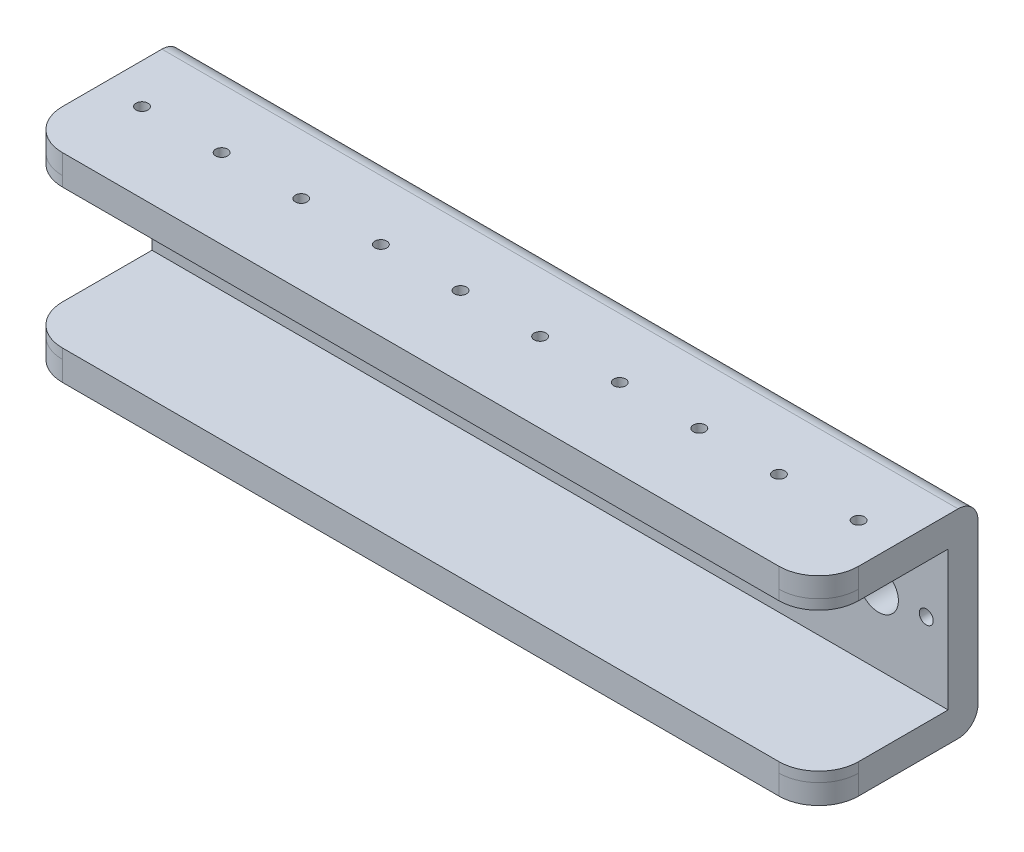
from build123d import *

# Parameters (mm, degrees)
SKETCH1_W           = 400
SKETCH1_H           = 80
BOSS_EXTRUDE1_DEPTH = 10
SKETCH2_W           = 400
SKETCH2_H           = 10
BOSS_EXTRUDE2_DEPTH = 80
SKETCH3_W           = 400
SKETCH3_H           = 10
BOSS_EXTRUDE3_DEPTH = 10
SKETCH4_W           = 400
SKETCH4_H           = 10
BOSS_EXTRUDE4_DEPTH = 70
FILLET1_R           = 20
FILLET2_R           = 10
CUT_EXTRUDE2_REACH  = 361.504
SKETCH6_R           = 2.5
SKETCH8_R           = 3.5
SKETCH8_R_2         = 10
SKETCH8_R_3         = 8.5
CUT_EXTRUDE3_DEPTH  = 10
CUT_EXTRUDE4_REACH  = 361.504
SKETCH9_R           = 3.5
SKETCH10_R          = 3.5
BOSS_EXTRUDE5_DEPTH = 10
CUT_EXTRUDE5_REACH  = 358.158
SKETCH11_R          = 3
SKETCH13_W          = 400
SKETCH13_H          = 80
SKETCH13_R          = 3.5
SKETCH13_R_2        = 10
SKETCH13_R_3        = 8.5
SKETCH13_R_4        = 2.5
BOSS_EXTRUDE7_DEPTH = 5
SKETCH16_W          = 400
SKETCH16_H          = 65
BOSS_EXTRUDE8_DEPTH = 5
FILLET3_R           = 20
SKETCH17_W          = 400
SKETCH17_H          = 65
SKETCH17_R          = 3
BOSS_EXTRUDE9_DEPTH = 5
FILLET4_R           = 20


with BuildPart() as part:
    # Sketch1 → Boss-Extrude1 (new body)
    with BuildSketch(Plane(origin=(0, 0, 0), x_dir=(1, 0, 0), z_dir=(0, 1, 0))):
        with Locations((135.921268108, 23.289271879)):
            Rectangle(SKETCH1_W, SKETCH1_H)
    extrude(amount=BOSS_EXTRUDE1_DEPTH)

    # Sketch2 → Boss-Extrude2 (add)
    with BuildSketch(Plane(origin=(0, 10, 0), x_dir=(1, 0, 0), z_dir=(0, 1, 0))):
        with Locations((135.921268108, 58.289271879)):
            Rectangle(SKETCH2_W, SKETCH2_H)
    extrude(amount=BOSS_EXTRUDE2_DEPTH)

    # Sketch3 → Boss-Extrude3 (add)
    with BuildSketch(Plane(origin=(0, 90, 0), x_dir=(1, 0, 0), z_dir=(0, 1, 0))):
        with Locations((135.921268108, 58.289271879)):
            Rectangle(SKETCH3_W, SKETCH3_H)
    extrude(amount=BOSS_EXTRUDE3_DEPTH)

    # Sketch4 → Boss-Extrude4 (add)
    with BuildSketch(Plane.XY.offset(-53.289271879)):
        with Locations((135.921268108, 95)):
            Rectangle(SKETCH4_W, SKETCH4_H)
    extrude(amount=BOSS_EXTRUDE4_DEPTH)

    # Fillet1
    fillet1_edges = [part.edges().sort_by_distance(p)[0] for p in [
        (-64.078731892, 95, 16.710728121),
        (335.921268108, 95, 16.710728121),
        (-64.078731892, 5, 16.710728121),
        (335.921268108, 5, 16.710728121),
    ]]
    fillet(fillet1_edges, radius=FILLET1_R)

    # Fillet2
    fillet2_edges = [part.edges().sort_by_distance(p)[0] for p in [
        (135.921268108, 100, -63.289271879),
        (135.921268108, 0, -63.289271879),
    ]]
    fillet(fillet2_edges, radius=FILLET2_R)

    # Sketch6 → Cut-Extrude2 (cut, up to next)
    with BuildSketch(Plane(origin=(0, 0, -63.289271879), x_dir=(-1, 0, 0), z_dir=(0, 0, -1)), mode=Mode.PRIVATE) as cut_extrude2_sk1:
        with Locations((-112.351268108, 73.57)):
            Circle(SKETCH6_R)
    cut_extrude2_tool1 = extrude(cut_extrude2_sk1.sketch, amount=-CUT_EXTRUDE2_REACH, mode=Mode.PRIVATE) & part.part
    # Sketch6 → Cut-Extrude2 (cut, up to next)
    with BuildSketch(Plane(origin=(0, 0, -63.289271879), x_dir=(-1, 0, 0), z_dir=(0, 0, -1)), mode=Mode.PRIVATE) as cut_extrude2_sk2:
        with Locations((-112.351268108, 26.43)):
            Circle(SKETCH6_R)
    cut_extrude2_tool2 = extrude(cut_extrude2_sk2.sketch, amount=-CUT_EXTRUDE2_REACH, mode=Mode.PRIVATE) & part.part
    # Sketch6 → Cut-Extrude2 (cut, up to next)
    with BuildSketch(Plane(origin=(0, 0, -63.289271879), x_dir=(-1, 0, 0), z_dir=(0, 0, -1)), mode=Mode.PRIVATE) as cut_extrude2_sk3:
        with Locations((-159.491268108, 26.43)):
            Circle(SKETCH6_R)
    cut_extrude2_tool3 = extrude(cut_extrude2_sk3.sketch, amount=-CUT_EXTRUDE2_REACH, mode=Mode.PRIVATE) & part.part
    # Sketch6 → Cut-Extrude2 (cut, up to next)
    with BuildSketch(Plane(origin=(0, 0, -63.289271879), x_dir=(-1, 0, 0), z_dir=(0, 0, -1)), mode=Mode.PRIVATE) as cut_extrude2_sk4:
        with Locations((-159.491268108, 73.57)):
            Circle(SKETCH6_R)
    cut_extrude2_tool4 = extrude(cut_extrude2_sk4.sketch, amount=-CUT_EXTRUDE2_REACH, mode=Mode.PRIVATE) & part.part
    add(cut_extrude2_tool1.solids().sort_by_distance((112.351268, 73.57, -63.289272))[0], mode=Mode.SUBTRACT)
    add(cut_extrude2_tool2.solids().sort_by_distance((112.351268, 26.43, -63.289272))[0], mode=Mode.SUBTRACT)
    add(cut_extrude2_tool3.solids().sort_by_distance((159.491268, 26.43, -63.289272))[0], mode=Mode.SUBTRACT)
    add(cut_extrude2_tool4.solids().sort_by_distance((159.491268, 73.57, -63.289272))[0], mode=Mode.SUBTRACT)

    # Sketch8 → Cut-Extrude3 (cut)
    with BuildSketch(Plane(origin=(0, 0, -63.289271879), x_dir=(-1, 0, 0), z_dir=(0, 0, -1))):
        with Locations((53.078731892, 50)):
            Circle(SKETCH8_R)
        with Locations((5.078731892, 50)):
            Circle(SKETCH8_R)
        with Locations((29.078731892, 50)):
            Circle(SKETCH8_R_2)
        with Locations((-276.921268108, 50)):
            Circle(SKETCH8_R)
        with Locations((-300.921268108, 50)):
            Circle(SKETCH8_R_2)
        with Locations((-135.921268108, 50)):
            Circle(SKETCH8_R_3)
        with Locations((-109.421268108, 50)):
            Circle(SKETCH8_R)
        with Locations((-162.421268108, 50)):
            Circle(SKETCH8_R)
        with Locations((-324.921268108, 50)):
            Circle(SKETCH8_R)
    extrude(amount=-CUT_EXTRUDE3_DEPTH, mode=Mode.SUBTRACT)

    # Sketch9 → Cut-Extrude4 (cut, up to next)
    with BuildSketch(Plane(origin=(0, 0, -63.289271879), x_dir=(-1, 0, 0), z_dir=(0, 0, -1)), mode=Mode.PRIVATE) as cut_extrude4_sk1:
        with Locations((-135.921268108, 76.5)):
            Circle(SKETCH9_R)
    cut_extrude4_tool1 = extrude(cut_extrude4_sk1.sketch, amount=-CUT_EXTRUDE4_REACH, mode=Mode.PRIVATE) & part.part
    # Sketch9 → Cut-Extrude4 (cut, up to next)
    with BuildSketch(Plane(origin=(0, 0, -63.289271879), x_dir=(-1, 0, 0), z_dir=(0, 0, -1)), mode=Mode.PRIVATE) as cut_extrude4_sk2:
        with Locations((-135.921268108, 23.5)):
            Circle(SKETCH9_R)
    cut_extrude4_tool2 = extrude(cut_extrude4_sk2.sketch, amount=-CUT_EXTRUDE4_REACH, mode=Mode.PRIVATE) & part.part
    add(cut_extrude4_tool1.solids().sort_by_distance((135.921268, 76.5, -63.289272))[0], mode=Mode.SUBTRACT)
    add(cut_extrude4_tool2.solids().sort_by_distance((135.921268, 23.5, -63.289272))[0], mode=Mode.SUBTRACT)

    # Sketch10 → Boss-Extrude5 (add)
    with BuildSketch(Plane(origin=(0, 0, -63.289271879), x_dir=(-1, 0, 0), z_dir=(0, 0, -1))):
        with Locations((-109.421268108, 50)):
            Circle(SKETCH10_R)
        with Locations((-162.421268108, 50)):
            Circle(SKETCH10_R)
    extrude(amount=-BOSS_EXTRUDE5_DEPTH)

    # Sketch11 → Cut-Extrude5 (cut, up to next)
    with BuildSketch(Plane(origin=(0, 100, 0), x_dir=(1, 0, 0), z_dir=(0, 1, 0)), mode=Mode.PRIVATE) as cut_extrude5_sk1:
        with Locations(Location((-44.078731892, 23.289271879, 0), (0, 0, 270))):
            Circle(SKETCH11_R)
    cut_extrude5_tool1 = extrude(cut_extrude5_sk1.sketch, amount=-CUT_EXTRUDE5_REACH, mode=Mode.PRIVATE) & part.part
    # Sketch11 → Cut-Extrude5 (cut, up to next)
    with BuildSketch(Plane(origin=(0, 100, 0), x_dir=(1, 0, 0), z_dir=(0, 1, 0)), mode=Mode.PRIVATE) as cut_extrude5_sk2:
        with Locations(Location((-4.078731892, 23.289271879, 0), (0, 0, 270))):
            Circle(SKETCH11_R)
    cut_extrude5_tool2 = extrude(cut_extrude5_sk2.sketch, amount=-CUT_EXTRUDE5_REACH, mode=Mode.PRIVATE) & part.part
    # Sketch11 → Cut-Extrude5 (cut, up to next)
    with BuildSketch(Plane(origin=(0, 100, 0), x_dir=(1, 0, 0), z_dir=(0, 1, 0)), mode=Mode.PRIVATE) as cut_extrude5_sk3:
        with Locations(Location((35.921268108, 23.289271879, 0), (0, 0, 270))):
            Circle(SKETCH11_R)
    cut_extrude5_tool3 = extrude(cut_extrude5_sk3.sketch, amount=-CUT_EXTRUDE5_REACH, mode=Mode.PRIVATE) & part.part
    # Sketch11 → Cut-Extrude5 (cut, up to next)
    with BuildSketch(Plane(origin=(0, 100, 0), x_dir=(1, 0, 0), z_dir=(0, 1, 0)), mode=Mode.PRIVATE) as cut_extrude5_sk4:
        with Locations(Location((75.921268108, 23.289271879, 0), (0, 0, 270))):
            Circle(SKETCH11_R)
    cut_extrude5_tool4 = extrude(cut_extrude5_sk4.sketch, amount=-CUT_EXTRUDE5_REACH, mode=Mode.PRIVATE) & part.part
    # Sketch11 → Cut-Extrude5 (cut, up to next)
    with BuildSketch(Plane(origin=(0, 100, 0), x_dir=(1, 0, 0), z_dir=(0, 1, 0)), mode=Mode.PRIVATE) as cut_extrude5_sk5:
        with Locations(Location((115.921268108, 23.289271879, 0), (0, 0, 270))):
            Circle(SKETCH11_R)
    cut_extrude5_tool5 = extrude(cut_extrude5_sk5.sketch, amount=-CUT_EXTRUDE5_REACH, mode=Mode.PRIVATE) & part.part
    # Sketch11 → Cut-Extrude5 (cut, up to next)
    with BuildSketch(Plane(origin=(0, 100, 0), x_dir=(1, 0, 0), z_dir=(0, 1, 0)), mode=Mode.PRIVATE) as cut_extrude5_sk6:
        with Locations(Location((155.921268108, 23.289271879, 0), (0, 0, 270))):
            Circle(SKETCH11_R)
    cut_extrude5_tool6 = extrude(cut_extrude5_sk6.sketch, amount=-CUT_EXTRUDE5_REACH, mode=Mode.PRIVATE) & part.part
    # Sketch11 → Cut-Extrude5 (cut, up to next)
    with BuildSketch(Plane(origin=(0, 100, 0), x_dir=(1, 0, 0), z_dir=(0, 1, 0)), mode=Mode.PRIVATE) as cut_extrude5_sk7:
        with Locations(Location((195.921268108, 23.289271879, 0), (0, 0, 270))):
            Circle(SKETCH11_R)
    cut_extrude5_tool7 = extrude(cut_extrude5_sk7.sketch, amount=-CUT_EXTRUDE5_REACH, mode=Mode.PRIVATE) & part.part
    # Sketch11 → Cut-Extrude5 (cut, up to next)
    with BuildSketch(Plane(origin=(0, 100, 0), x_dir=(1, 0, 0), z_dir=(0, 1, 0)), mode=Mode.PRIVATE) as cut_extrude5_sk8:
        with Locations(Location((235.921268108, 23.289271879, 0), (0, 0, 270))):
            Circle(SKETCH11_R)
    cut_extrude5_tool8 = extrude(cut_extrude5_sk8.sketch, amount=-CUT_EXTRUDE5_REACH, mode=Mode.PRIVATE) & part.part
    # Sketch11 → Cut-Extrude5 (cut, up to next)
    with BuildSketch(Plane(origin=(0, 100, 0), x_dir=(1, 0, 0), z_dir=(0, 1, 0)), mode=Mode.PRIVATE) as cut_extrude5_sk9:
        with Locations(Location((275.921268108, 23.289271879, 0), (0, 0, 270))):
            Circle(SKETCH11_R)
    cut_extrude5_tool9 = extrude(cut_extrude5_sk9.sketch, amount=-CUT_EXTRUDE5_REACH, mode=Mode.PRIVATE) & part.part
    # Sketch11 → Cut-Extrude5 (cut, up to next)
    with BuildSketch(Plane(origin=(0, 100, 0), x_dir=(1, 0, 0), z_dir=(0, 1, 0)), mode=Mode.PRIVATE) as cut_extrude5_sk10:
        with Locations(Location((315.921268108, 23.289271879, 0), (0, 0, 270))):
            Circle(SKETCH11_R)
    cut_extrude5_tool10 = extrude(cut_extrude5_sk10.sketch, amount=-CUT_EXTRUDE5_REACH, mode=Mode.PRIVATE) & part.part
    add(cut_extrude5_tool1.solids().sort_by_distance((-44.078732, 100, -23.289272))[0], mode=Mode.SUBTRACT)
    add(cut_extrude5_tool2.solids().sort_by_distance((-4.078732, 100, -23.289272))[0], mode=Mode.SUBTRACT)
    add(cut_extrude5_tool3.solids().sort_by_distance((35.921268, 100, -23.289272))[0], mode=Mode.SUBTRACT)
    add(cut_extrude5_tool4.solids().sort_by_distance((75.921268, 100, -23.289272))[0], mode=Mode.SUBTRACT)
    add(cut_extrude5_tool5.solids().sort_by_distance((115.921268, 100, -23.289272))[0], mode=Mode.SUBTRACT)
    add(cut_extrude5_tool6.solids().sort_by_distance((155.921268, 100, -23.289272))[0], mode=Mode.SUBTRACT)
    add(cut_extrude5_tool7.solids().sort_by_distance((195.921268, 100, -23.289272))[0], mode=Mode.SUBTRACT)
    add(cut_extrude5_tool8.solids().sort_by_distance((235.921268, 100, -23.289272))[0], mode=Mode.SUBTRACT)
    add(cut_extrude5_tool9.solids().sort_by_distance((275.921268, 100, -23.289272))[0], mode=Mode.SUBTRACT)
    add(cut_extrude5_tool10.solids().sort_by_distance((315.921268, 100, -23.289272))[0], mode=Mode.SUBTRACT)

    # Sketch13 → Boss-Extrude7 (add)
    with BuildSketch(Plane.XY.offset(-53.289271879)):
        with Locations((135.921268108, 50)):
            Rectangle(SKETCH13_W, SKETCH13_H)
        with Locations(Location((135.921268108, 76.5, 0), (0, 0, 180))):
            Circle(SKETCH13_R, mode=Mode.SUBTRACT)
        with Locations(Location((-29.078731892, 50, 0), (0, 0, 180))):
            Circle(SKETCH13_R_2, mode=Mode.SUBTRACT)
        with Locations(Location((135.921268108, 50, 0), (0, 0, 180))):
            Circle(SKETCH13_R_3, mode=Mode.SUBTRACT)
        with Locations(Location((300.921268108, 50, 0), (0, 0, 180))):
            Circle(SKETCH13_R_2, mode=Mode.SUBTRACT)
        with Locations(Location((112.351268108, 26.43, 0), (0, 0, 180))):
            Circle(SKETCH13_R_4, mode=Mode.SUBTRACT)
        with Locations(Location((159.491268108, 73.57, 0), (0, 0, 180))):
            Circle(SKETCH13_R_4, mode=Mode.SUBTRACT)
        with Locations(Location((112.351268108, 73.57, 0), (0, 0, 180))):
            Circle(SKETCH13_R_4, mode=Mode.SUBTRACT)
        with Locations(Location((159.491268108, 26.43, 0), (0, 0, 180))):
            Circle(SKETCH13_R_4, mode=Mode.SUBTRACT)
        with Locations(Location((324.921268108, 50, 0), (0, 0, 180))):
            Circle(SKETCH13_R, mode=Mode.SUBTRACT)
        with Locations(Location((276.921268108, 50, 0), (0, 0, 180))):
            Circle(SKETCH13_R, mode=Mode.SUBTRACT)
        with Locations(Location((-5.078731892, 50, 0), (0, 0, 180))):
            Circle(SKETCH13_R, mode=Mode.SUBTRACT)
        with Locations(Location((-53.078731892, 50, 0), (0, 0, 180))):
            Circle(SKETCH13_R, mode=Mode.SUBTRACT)
        with Locations(Location((135.921268108, 23.5, 0), (0, 0, 180))):
            Circle(SKETCH13_R, mode=Mode.SUBTRACT)
    extrude(amount=BOSS_EXTRUDE7_DEPTH)

    # Sketch16 → Boss-Extrude8 (add)
    with BuildSketch(Plane(origin=(0, 10, 0), x_dir=(1, 0, 0), z_dir=(0, 1, 0))):
        with Locations((135.921268108, 15.789271879)):
            Rectangle(SKETCH16_W, SKETCH16_H)
    extrude(amount=BOSS_EXTRUDE8_DEPTH)

    # Fillet3
    fillet3_edges = [part.edges().sort_by_distance(p)[0] for p in [
        (-64.078731892, 12.5, 16.710728121),
        (335.921268108, 12.5, 16.710728121),
    ]]
    fillet(fillet3_edges, radius=FILLET3_R)

    # Sketch17 → Boss-Extrude9 (add)
    with BuildSketch(Plane.XZ.offset(-90)):
        with Locations((135.921268108, -15.789271879)):
            Rectangle(SKETCH17_W, SKETCH17_H)
        with Locations(Location((-44.078731892, -23.289271879, 0), (0, 0, 90))):
            Circle(SKETCH17_R, mode=Mode.SUBTRACT)
        with Locations(Location((-4.078731892, -23.289271879, 0), (0, 0, 90))):
            Circle(SKETCH17_R, mode=Mode.SUBTRACT)
        with Locations(Location((35.921268108, -23.289271879, 0), (0, 0, 90))):
            Circle(SKETCH17_R, mode=Mode.SUBTRACT)
        with Locations(Location((75.921268108, -23.289271879, 0), (0, 0, 90))):
            Circle(SKETCH17_R, mode=Mode.SUBTRACT)
        with Locations(Location((115.921268108, -23.289271879, 0), (0, 0, 90))):
            Circle(SKETCH17_R, mode=Mode.SUBTRACT)
        with Locations(Location((155.921268108, -23.289271879, 0), (0, 0, 90))):
            Circle(SKETCH17_R, mode=Mode.SUBTRACT)
        with Locations(Location((195.921268108, -23.289271879, 0), (0, 0, 90))):
            Circle(SKETCH17_R, mode=Mode.SUBTRACT)
        with Locations(Location((235.921268108, -23.289271879, 0), (0, 0, 90))):
            Circle(SKETCH17_R, mode=Mode.SUBTRACT)
        with Locations(Location((275.921268108, -23.289271879, 0), (0, 0, 90))):
            Circle(SKETCH17_R, mode=Mode.SUBTRACT)
        with Locations(Location((315.921268108, -23.289271879, 0), (0, 0, 90))):
            Circle(SKETCH17_R, mode=Mode.SUBTRACT)
    extrude(amount=BOSS_EXTRUDE9_DEPTH)

    # Fillet4
    fillet4_edges = [part.edges().sort_by_distance(p)[0] for p in [
        (335.921268108, 87.5, 16.710728121),
        (-64.078731892, 87.5, 16.710728121),
    ]]
    fillet(fillet4_edges, radius=FILLET4_R - 0.0001)  # a hair under: the kernel refuses the full size


solid = part.part
